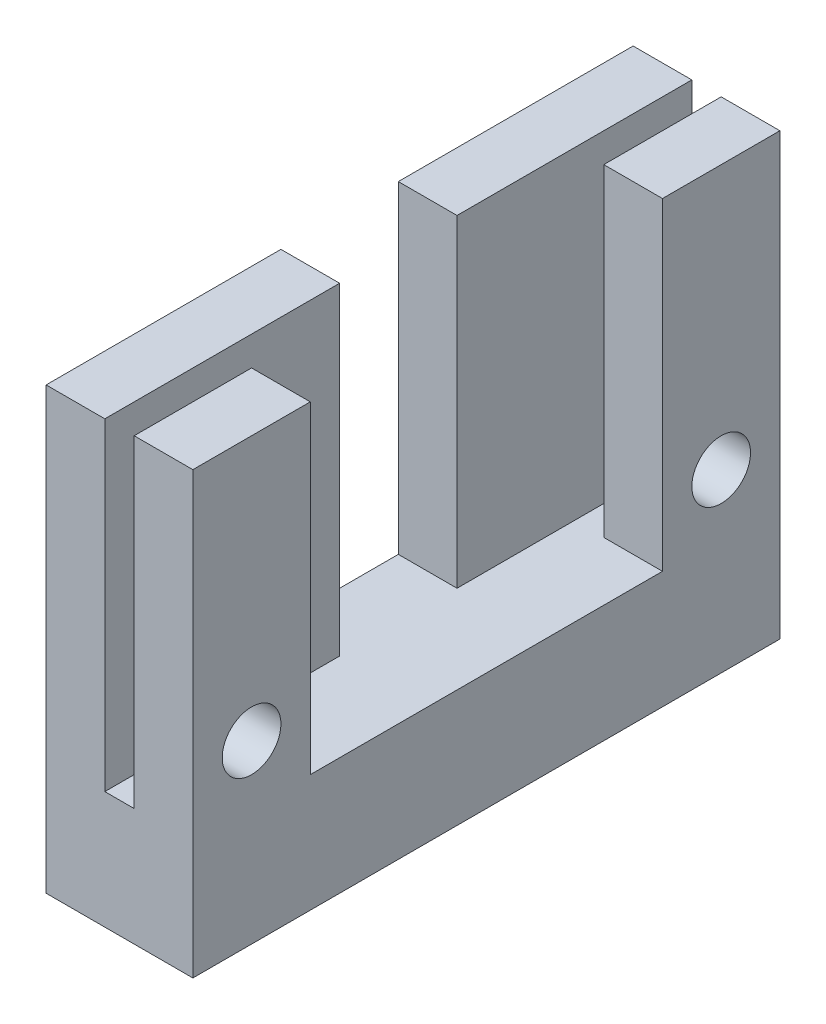
from build123d import *

# Parameters (mm, degrees)
SKETCH1_W           = 20
SKETCH1_H           = 15
BOSS_EXTRUDE1_DEPTH = 5
SKETCH2_W           = 1
SKETCH2_H           = 11
CUT_EXTRUDE1_DEPTH  = 22.937410968
CUT_EXTRUDE2_REACH  = 15.463
SKETCH3_W           = 12
SKETCH3_H           = 11
CUT_EXTRUDE3_REACH  = 14.855
SKETCH4_W           = 4
SKETCH4_H           = 11
SKETCH5_R           = 1
CUT_EXTRUDE4_DEPTH  = 14.462912018


with BuildPart() as part:
    # Sketch1 → Boss-Extrude1 (new body)
    with BuildSketch(Plane(origin=(0, 0, 0), x_dir=(0, 0, -1), z_dir=(1, 0, 0))):
        Rectangle(SKETCH1_W, SKETCH1_H)
    extrude(amount=BOSS_EXTRUDE1_DEPTH)

    # Sketch2 → Cut-Extrude1 (cut, through all)
    with BuildSketch(Plane.XY.offset(10)):
        with Locations((2.5, 2)):
            Rectangle(SKETCH2_W, SKETCH2_H)
    extrude(amount=-CUT_EXTRUDE1_DEPTH, mode=Mode.SUBTRACT)

    # Sketch3 → Cut-Extrude2 (cut, up to next)
    with BuildSketch(Plane(origin=(5, 0, 0), x_dir=(0, 0, -1), z_dir=(1, 0, 0)), mode=Mode.PRIVATE) as cut_extrude2_sk1:
        with Locations((0, 2)):
            Rectangle(SKETCH3_W, SKETCH3_H)
    cut_extrude2_tool1 = extrude(cut_extrude2_sk1.sketch, amount=-CUT_EXTRUDE2_REACH, mode=Mode.PRIVATE) & part.part
    add(cut_extrude2_tool1.solids().sort_by_distance((5, 2, 0))[0], mode=Mode.SUBTRACT)

    # Sketch4 → Cut-Extrude3 (cut, up to next)
    with BuildSketch(Plane(origin=(2, 0, 0), x_dir=(0, 0, -1), z_dir=(1, 0, 0)), mode=Mode.PRIVATE) as cut_extrude3_sk1:
        with Locations((0, 2)):
            Rectangle(SKETCH4_W, SKETCH4_H)
    cut_extrude3_tool1 = extrude(cut_extrude3_sk1.sketch, amount=-CUT_EXTRUDE3_REACH, mode=Mode.PRIVATE) & part.part
    add(cut_extrude3_tool1.solids().sort_by_distance((2, 2, 0))[0], mode=Mode.SUBTRACT)

    # Sketch5 → Cut-Extrude4 (cut, through all)
    with BuildSketch(Plane(origin=(5, 0, 0), x_dir=(0, 0, -1), z_dir=(1, 0, 0))):
        with Locations((-8, -1.5)):
            Circle(SKETCH5_R)
    cut_extrude4 = extrude(amount=-CUT_EXTRUDE4_DEPTH, mode=Mode.SUBTRACT)

    # Mirror1: Cut-Extrude4 across plane
    add(cut_extrude4.mirror(Plane.XY), mode=Mode.SUBTRACT)


solid = part.part
